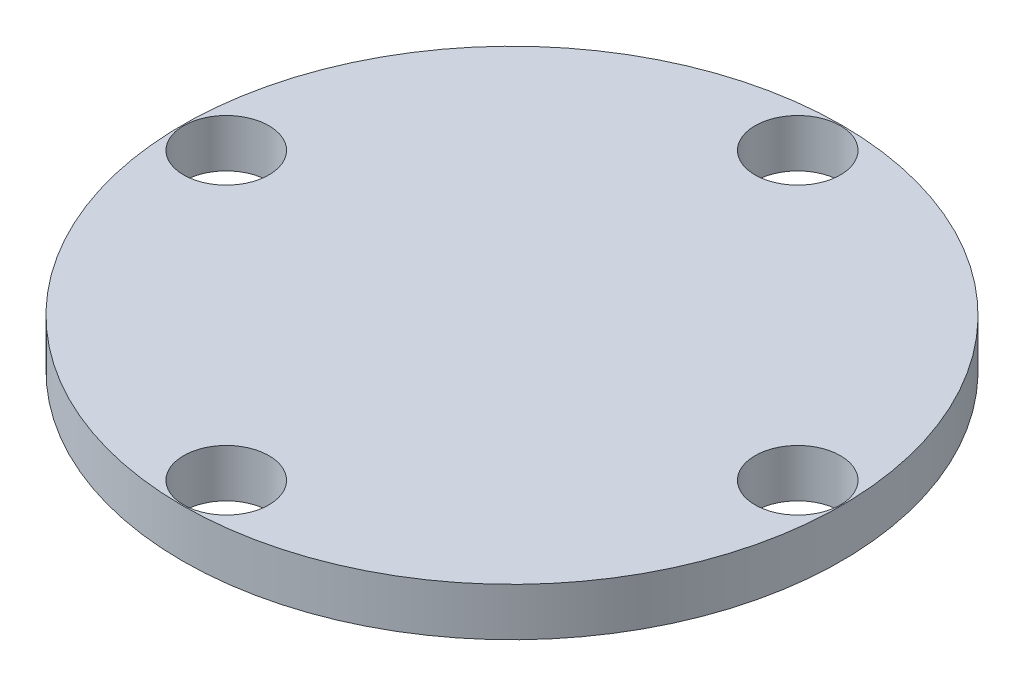
from build123d import *

# Parameters (mm, degrees)
SKETCH1_R           = 10.9855
BOSS_EXTRUDE1_DEPTH = 1.6002
SKETCH2_R           = 1.4224
CUT_EXTRUDE1_DEPTH  = 1.6002
CIRPATTERN1_COUNT   = 4


with BuildPart() as part:
    # Sketch1 → Boss-Extrude1 (new body)
    with BuildSketch(Plane(origin=(0, 0, 0), x_dir=(1, 0, 0), z_dir=(0, 1, 0))):
        Circle(SKETCH1_R)
    extrude(amount=BOSS_EXTRUDE1_DEPTH)

    # Sketch2 → Cut-Extrude1 (cut)
    with BuildSketch(Plane(origin=(0, 1.6002, 0), x_dir=(1, 0, 0), z_dir=(0, 1, 0))):
        with Locations((-9.525, 0)):
            Circle(SKETCH2_R)
    cut_extrude1 = extrude(amount=-CUT_EXTRUDE1_DEPTH, mode=Mode.SUBTRACT)

    # CirPattern1: Cut-Extrude1 ×4 about axis
    cirpattern1_axis = Axis((0, 1.6002, 0), (0, -1, 0))
    for i in range(1, CIRPATTERN1_COUNT):
        add(cut_extrude1.rotate(cirpattern1_axis, i * 360 / CIRPATTERN1_COUNT), mode=Mode.SUBTRACT)


solid = part.part
